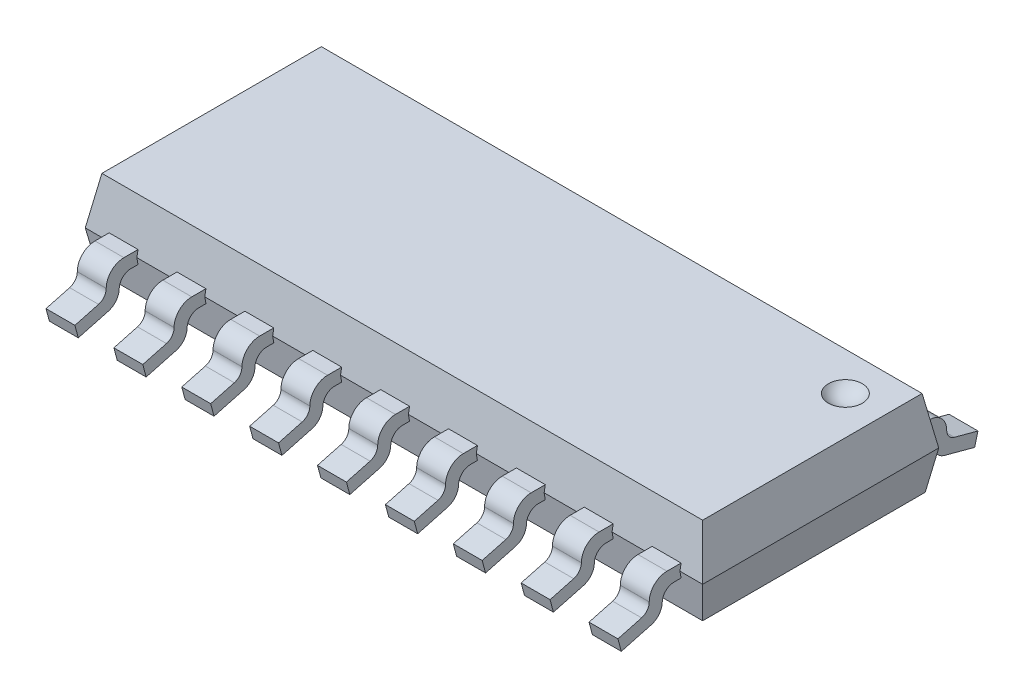
from build123d import *

# Parameters (mm, degrees)
BOSS_EXTRUDE1_DEPTH   = 5.23
CUT_EXTRUDE1_DEPTH    = 4.375
BOSS_EXTRUDE3_DEPTH   = 0.245
LPATTERN1_COUNT       = 5
LPATTERN1_PITCH       = 1.15
LPATTERN1_COUNT_DIR2  = 5
LPATTERN1_PITCH_DIR2  = 1.15
MIRROR1_COPY_1_DEPTH  = 0.245
MIRROR1_COPY_2_DEPTH  = 0.245
MIRROR1_COPY_3_DEPTH  = 0.245
MIRROR1_COPY_4_DEPTH  = 0.245
MIRROR1_COPY_5_DEPTH  = 0.245
MIRROR1_COPY_6_DEPTH  = 0.245
MIRROR1_COPY_7_DEPTH  = 0.245
MIRROR1_COPY_8_DEPTH  = 0.245
MIRROR1_COPY_9_DEPTH  = 0.245
MIRROR1_COPY_10_DEPTH = 0.245
MIRROR1_COPY_11_DEPTH = 0.245
MIRROR1_COPY_12_DEPTH = 0.245
MIRROR1_COPY_13_DEPTH = 0.245
MIRROR1_COPY_14_DEPTH = 0.245
MIRROR1_COPY_15_DEPTH = 0.245
MIRROR1_COPY_16_DEPTH = 0.245
MIRROR1_COPY_17_DEPTH = 0.245
MIRROR1_COPY_18_DEPTH = 0.245
MIRROR1_COPY_19_DEPTH = 0.245
MIRROR1_COPY_20_DEPTH = 0.245
MIRROR1_COPY_21_DEPTH = 0.245
MIRROR1_COPY_22_DEPTH = 0.245
MIRROR1_COPY_23_DEPTH = 0.245
MIRROR1_COPY_24_DEPTH = 0.245


with BuildPart() as part:
    # Sketch3 → Boss-Extrude1 (new, symmetric)
    with BuildSketch(Plane(origin=(0, 0, 0), x_dir=(0, 0, -1), z_dir=(1, 0, 0))):
        Polygon((-2, 0), (-1.885387463, -0.65), (1.885387463, -0.65), (2, 0), (1.858938415, 0.8), (-1.858938415, 0.8), align=None)
    extrude(amount=BOSS_EXTRUDE1_DEPTH, both=True)

    # Sketch4 → Cut-Extrude1 (cut, symmetric)
    with BuildSketch(Plane.XY):
        Polygon((-5.23, 0), (-5.088938415, 0.8), (-6, 0.8), (-6, -0.65), (-5.115387463, -0.65), align=None)
        Polygon((6, -0.65), (6, 0.8), (5.088938415, 0.8), (5.23, 0), (5.115387463, -0.65), align=None)
    extrude(amount=CUT_EXTRUDE1_DEPTH, both=True, mode=Mode.SUBTRACT)

    # Sketch8 → Boss-Extrude3 (add, symmetric)
    with BuildSketch(Plane(origin=(0, 0, 0), x_dir=(0, 0, -1), z_dir=(1, 0, 0))):
        with BuildLine():
            Line((-2, 0), (-1.980604032, 0.11))
            Line((-1.980604032, 0.11), (-2.22, 0.11))
            ThreePointArc((-2.22, 0.11), (-2.432132034, 0.022132034), (-2.52, -0.19))
            Line((-2.52, -0.19), (-2.52, -0.191271738))
            ThreePointArc((-2.52, -0.191271738), (-2.556144122, -0.297748886), (-2.649638362, -0.360219741))
            Line((-2.649638362, -0.360219741), (-3.05, -0.467496318))
            Line((-3.05, -0.467496318), (-2.99305981, -0.68))
            Line((-2.99305981, -0.68), (-2.485295239, -0.543944893))
            ThreePointArc((-2.485295239, -0.543944893), (-2.351661665, -0.454653794), (-2.3, -0.302463437))
            Line((-2.3, -0.302463437), (-2.3, -0.31))
            ThreePointArc((-2.3, -0.31), (-2.241421356, -0.168578644), (-2.1, -0.11))
            Line((-2.1, -0.11), (-1.980604032, -0.11))
            Line((-1.980604032, -0.11), (-2, 0))
        make_face()
    boss_extrude3 = extrude(amount=BOSS_EXTRUDE3_DEPTH, both=True)

    # Sketch9 → Cut-Revolve1 (revolve, cut)
    with BuildSketch(Plane(origin=(0, 1, 0), x_dir=(1, 0, 0), z_dir=(0, 1, 0))):
        with BuildLine():
            Line((4.788938415, 1.208938415), (4.088938415, 1.208938415))
            ThreePointArc((4.088938415, 1.208938415), (4.438938415, 1.558938415), (4.788938415, 1.208938415))
        make_face()
    revolve(axis=Axis((4.788938415, 1, -1.208938415), (-1, 0, 0)), mode=Mode.SUBTRACT)

    # LPattern1: Boss-Extrude3 5 × 5
    with Locations(*[Vector(1, 0, 0) * (i * LPATTERN1_PITCH) + Vector(-1, 0, 0) * (j * LPATTERN1_PITCH_DIR2) for i in range(LPATTERN1_COUNT) for j in range(LPATTERN1_COUNT_DIR2) if (i, j) != (0, 0)]):
        add(boss_extrude3)

    # Mirror1: Boss-Extrude3 across plane
    add(boss_extrude3.mirror(Plane.XY))

    # Mirror1 copy 1 sketch → Mirror1 copy 1 (add, symmetric)
    with BuildSketch(Plane(origin=(-1.15, 0, 0), x_dir=(0, 0, 1), z_dir=(1, 0, 0))):
        with BuildLine():
            Line((-2, 0), (-1.980604032, -0.11))
            Line((-1.980604032, -0.11), (-2.22, -0.11))
            ThreePointArc((-2.22, -0.11), (-2.432132034, -0.022132034), (-2.52, 0.19))
            Line((-2.52, 0.19), (-2.52, 0.191271738))
            ThreePointArc((-2.52, 0.191271738), (-2.556144122, 0.297748886), (-2.649638362, 0.360219741))
            Line((-2.649638362, 0.360219741), (-3.05, 0.467496318))
            Line((-3.05, 0.467496318), (-2.99305981, 0.68))
            Line((-2.99305981, 0.68), (-2.485295239, 0.543944893))
            ThreePointArc((-2.485295239, 0.543944893), (-2.351661665, 0.454653794), (-2.3, 0.302463437))
            Line((-2.3, 0.302463437), (-2.3, 0.31))
            ThreePointArc((-2.3, 0.31), (-2.241421356, 0.168578644), (-2.1, 0.11))
            Line((-2.1, 0.11), (-1.980604032, 0.11))
            Line((-1.980604032, 0.11), (-2, 0))
        make_face()
    extrude(amount=MIRROR1_COPY_1_DEPTH, both=True)

    # Mirror1 copy 2 sketch → Mirror1 copy 2 (add, symmetric)
    with BuildSketch(Plane(origin=(-2.3, 0, 0), x_dir=(0, 0, 1), z_dir=(1, 0, 0))):
        with BuildLine():
            Line((-2, 0), (-1.980604032, -0.11))
            Line((-1.980604032, -0.11), (-2.22, -0.11))
            ThreePointArc((-2.22, -0.11), (-2.432132034, -0.022132034), (-2.52, 0.19))
            Line((-2.52, 0.19), (-2.52, 0.191271738))
            ThreePointArc((-2.52, 0.191271738), (-2.556144122, 0.297748886), (-2.649638362, 0.360219741))
            Line((-2.649638362, 0.360219741), (-3.05, 0.467496318))
            Line((-3.05, 0.467496318), (-2.99305981, 0.68))
            Line((-2.99305981, 0.68), (-2.485295239, 0.543944893))
            ThreePointArc((-2.485295239, 0.543944893), (-2.351661665, 0.454653794), (-2.3, 0.302463437))
            Line((-2.3, 0.302463437), (-2.3, 0.31))
            ThreePointArc((-2.3, 0.31), (-2.241421356, 0.168578644), (-2.1, 0.11))
            Line((-2.1, 0.11), (-1.980604032, 0.11))
            Line((-1.980604032, 0.11), (-2, 0))
        make_face()
    extrude(amount=MIRROR1_COPY_2_DEPTH, both=True)

    # Mirror1 copy 3 sketch → Mirror1 copy 3 (add, symmetric)
    with BuildSketch(Plane(origin=(-3.45, 0, 0), x_dir=(0, 0, 1), z_dir=(1, 0, 0))):
        with BuildLine():
            Line((-2, 0), (-1.980604032, -0.11))
            Line((-1.980604032, -0.11), (-2.22, -0.11))
            ThreePointArc((-2.22, -0.11), (-2.432132034, -0.022132034), (-2.52, 0.19))
            Line((-2.52, 0.19), (-2.52, 0.191271738))
            ThreePointArc((-2.52, 0.191271738), (-2.556144122, 0.297748886), (-2.649638362, 0.360219741))
            Line((-2.649638362, 0.360219741), (-3.05, 0.467496318))
            Line((-3.05, 0.467496318), (-2.99305981, 0.68))
            Line((-2.99305981, 0.68), (-2.485295239, 0.543944893))
            ThreePointArc((-2.485295239, 0.543944893), (-2.351661665, 0.454653794), (-2.3, 0.302463437))
            Line((-2.3, 0.302463437), (-2.3, 0.31))
            ThreePointArc((-2.3, 0.31), (-2.241421356, 0.168578644), (-2.1, 0.11))
            Line((-2.1, 0.11), (-1.980604032, 0.11))
            Line((-1.980604032, 0.11), (-2, 0))
        make_face()
    extrude(amount=MIRROR1_COPY_3_DEPTH, both=True)

    # Mirror1 copy 4 sketch → Mirror1 copy 4 (add, symmetric)
    with BuildSketch(Plane(origin=(-4.6, 0, 0), x_dir=(0, 0, 1), z_dir=(1, 0, 0))):
        with BuildLine():
            Line((-2, 0), (-1.980604032, -0.11))
            Line((-1.980604032, -0.11), (-2.22, -0.11))
            ThreePointArc((-2.22, -0.11), (-2.432132034, -0.022132034), (-2.52, 0.19))
            Line((-2.52, 0.19), (-2.52, 0.191271738))
            ThreePointArc((-2.52, 0.191271738), (-2.556144122, 0.297748886), (-2.649638362, 0.360219741))
            Line((-2.649638362, 0.360219741), (-3.05, 0.467496318))
            Line((-3.05, 0.467496318), (-2.99305981, 0.68))
            Line((-2.99305981, 0.68), (-2.485295239, 0.543944893))
            ThreePointArc((-2.485295239, 0.543944893), (-2.351661665, 0.454653794), (-2.3, 0.302463437))
            Line((-2.3, 0.302463437), (-2.3, 0.31))
            ThreePointArc((-2.3, 0.31), (-2.241421356, 0.168578644), (-2.1, 0.11))
            Line((-2.1, 0.11), (-1.980604032, 0.11))
            Line((-1.980604032, 0.11), (-2, 0))
        make_face()
    extrude(amount=MIRROR1_COPY_4_DEPTH, both=True)

    # Mirror1 copy 5 sketch → Mirror1 copy 5 (add, symmetric)
    with BuildSketch(Plane(origin=(1.15, 0, 0), x_dir=(0, 0, 1), z_dir=(1, 0, 0))):
        with BuildLine():
            Line((-2, 0), (-1.980604032, -0.11))
            Line((-1.980604032, -0.11), (-2.22, -0.11))
            ThreePointArc((-2.22, -0.11), (-2.432132034, -0.022132034), (-2.52, 0.19))
            Line((-2.52, 0.19), (-2.52, 0.191271738))
            ThreePointArc((-2.52, 0.191271738), (-2.556144122, 0.297748886), (-2.649638362, 0.360219741))
            Line((-2.649638362, 0.360219741), (-3.05, 0.467496318))
            Line((-3.05, 0.467496318), (-2.99305981, 0.68))
            Line((-2.99305981, 0.68), (-2.485295239, 0.543944893))
            ThreePointArc((-2.485295239, 0.543944893), (-2.351661665, 0.454653794), (-2.3, 0.302463437))
            Line((-2.3, 0.302463437), (-2.3, 0.31))
            ThreePointArc((-2.3, 0.31), (-2.241421356, 0.168578644), (-2.1, 0.11))
            Line((-2.1, 0.11), (-1.980604032, 0.11))
            Line((-1.980604032, 0.11), (-2, 0))
        make_face()
    extrude(amount=MIRROR1_COPY_5_DEPTH, both=True)

    # Mirror1 copy 6 sketch → Mirror1 copy 6 (add, symmetric)
    with BuildSketch(Plane(origin=(0, 0, 0), x_dir=(0, 0, 1), z_dir=(1, 0, 0))):
        with BuildLine():
            Line((-2, 0), (-1.980604032, -0.11))
            Line((-1.980604032, -0.11), (-2.22, -0.11))
            ThreePointArc((-2.22, -0.11), (-2.432132034, -0.022132034), (-2.52, 0.19))
            Line((-2.52, 0.19), (-2.52, 0.191271738))
            ThreePointArc((-2.52, 0.191271738), (-2.556144122, 0.297748886), (-2.649638362, 0.360219741))
            Line((-2.649638362, 0.360219741), (-3.05, 0.467496318))
            Line((-3.05, 0.467496318), (-2.99305981, 0.68))
            Line((-2.99305981, 0.68), (-2.485295239, 0.543944893))
            ThreePointArc((-2.485295239, 0.543944893), (-2.351661665, 0.454653794), (-2.3, 0.302463437))
            Line((-2.3, 0.302463437), (-2.3, 0.31))
            ThreePointArc((-2.3, 0.31), (-2.241421356, 0.168578644), (-2.1, 0.11))
            Line((-2.1, 0.11), (-1.980604032, 0.11))
            Line((-1.980604032, 0.11), (-2, 0))
        make_face()
    extrude(amount=MIRROR1_COPY_6_DEPTH, both=True)

    # Mirror1 copy 7 sketch → Mirror1 copy 7 (add, symmetric)
    with BuildSketch(Plane(origin=(-1.15, 0, 0), x_dir=(0, 0, 1), z_dir=(1, 0, 0))):
        with BuildLine():
            Line((-2, 0), (-1.980604032, -0.11))
            Line((-1.980604032, -0.11), (-2.22, -0.11))
            ThreePointArc((-2.22, -0.11), (-2.432132034, -0.022132034), (-2.52, 0.19))
            Line((-2.52, 0.19), (-2.52, 0.191271738))
            ThreePointArc((-2.52, 0.191271738), (-2.556144122, 0.297748886), (-2.649638362, 0.360219741))
            Line((-2.649638362, 0.360219741), (-3.05, 0.467496318))
            Line((-3.05, 0.467496318), (-2.99305981, 0.68))
            Line((-2.99305981, 0.68), (-2.485295239, 0.543944893))
            ThreePointArc((-2.485295239, 0.543944893), (-2.351661665, 0.454653794), (-2.3, 0.302463437))
            Line((-2.3, 0.302463437), (-2.3, 0.31))
            ThreePointArc((-2.3, 0.31), (-2.241421356, 0.168578644), (-2.1, 0.11))
            Line((-2.1, 0.11), (-1.980604032, 0.11))
            Line((-1.980604032, 0.11), (-2, 0))
        make_face()
    extrude(amount=MIRROR1_COPY_7_DEPTH, both=True)

    # Mirror1 copy 8 sketch → Mirror1 copy 8 (add, symmetric)
    with BuildSketch(Plane(origin=(-2.3, 0, 0), x_dir=(0, 0, 1), z_dir=(1, 0, 0))):
        with BuildLine():
            Line((-2, 0), (-1.980604032, -0.11))
            Line((-1.980604032, -0.11), (-2.22, -0.11))
            ThreePointArc((-2.22, -0.11), (-2.432132034, -0.022132034), (-2.52, 0.19))
            Line((-2.52, 0.19), (-2.52, 0.191271738))
            ThreePointArc((-2.52, 0.191271738), (-2.556144122, 0.297748886), (-2.649638362, 0.360219741))
            Line((-2.649638362, 0.360219741), (-3.05, 0.467496318))
            Line((-3.05, 0.467496318), (-2.99305981, 0.68))
            Line((-2.99305981, 0.68), (-2.485295239, 0.543944893))
            ThreePointArc((-2.485295239, 0.543944893), (-2.351661665, 0.454653794), (-2.3, 0.302463437))
            Line((-2.3, 0.302463437), (-2.3, 0.31))
            ThreePointArc((-2.3, 0.31), (-2.241421356, 0.168578644), (-2.1, 0.11))
            Line((-2.1, 0.11), (-1.980604032, 0.11))
            Line((-1.980604032, 0.11), (-2, 0))
        make_face()
    extrude(amount=MIRROR1_COPY_8_DEPTH, both=True)

    # Mirror1 copy 9 sketch → Mirror1 copy 9 (add, symmetric)
    with BuildSketch(Plane(origin=(-3.45, 0, 0), x_dir=(0, 0, 1), z_dir=(1, 0, 0))):
        with BuildLine():
            Line((-2, 0), (-1.980604032, -0.11))
            Line((-1.980604032, -0.11), (-2.22, -0.11))
            ThreePointArc((-2.22, -0.11), (-2.432132034, -0.022132034), (-2.52, 0.19))
            Line((-2.52, 0.19), (-2.52, 0.191271738))
            ThreePointArc((-2.52, 0.191271738), (-2.556144122, 0.297748886), (-2.649638362, 0.360219741))
            Line((-2.649638362, 0.360219741), (-3.05, 0.467496318))
            Line((-3.05, 0.467496318), (-2.99305981, 0.68))
            Line((-2.99305981, 0.68), (-2.485295239, 0.543944893))
            ThreePointArc((-2.485295239, 0.543944893), (-2.351661665, 0.454653794), (-2.3, 0.302463437))
            Line((-2.3, 0.302463437), (-2.3, 0.31))
            ThreePointArc((-2.3, 0.31), (-2.241421356, 0.168578644), (-2.1, 0.11))
            Line((-2.1, 0.11), (-1.980604032, 0.11))
            Line((-1.980604032, 0.11), (-2, 0))
        make_face()
    extrude(amount=MIRROR1_COPY_9_DEPTH, both=True)

    # Mirror1 copy 10 sketch → Mirror1 copy 10 (add, symmetric)
    with BuildSketch(Plane(origin=(2.3, 0, 0), x_dir=(0, 0, 1), z_dir=(1, 0, 0))):
        with BuildLine():
            Line((-2, 0), (-1.980604032, -0.11))
            Line((-1.980604032, -0.11), (-2.22, -0.11))
            ThreePointArc((-2.22, -0.11), (-2.432132034, -0.022132034), (-2.52, 0.19))
            Line((-2.52, 0.19), (-2.52, 0.191271738))
            ThreePointArc((-2.52, 0.191271738), (-2.556144122, 0.297748886), (-2.649638362, 0.360219741))
            Line((-2.649638362, 0.360219741), (-3.05, 0.467496318))
            Line((-3.05, 0.467496318), (-2.99305981, 0.68))
            Line((-2.99305981, 0.68), (-2.485295239, 0.543944893))
            ThreePointArc((-2.485295239, 0.543944893), (-2.351661665, 0.454653794), (-2.3, 0.302463437))
            Line((-2.3, 0.302463437), (-2.3, 0.31))
            ThreePointArc((-2.3, 0.31), (-2.241421356, 0.168578644), (-2.1, 0.11))
            Line((-2.1, 0.11), (-1.980604032, 0.11))
            Line((-1.980604032, 0.11), (-2, 0))
        make_face()
    extrude(amount=MIRROR1_COPY_10_DEPTH, both=True)

    # Mirror1 copy 11 sketch → Mirror1 copy 11 (add, symmetric)
    with BuildSketch(Plane(origin=(1.15, 0, 0), x_dir=(0, 0, 1), z_dir=(1, 0, 0))):
        with BuildLine():
            Line((-2, 0), (-1.980604032, -0.11))
            Line((-1.980604032, -0.11), (-2.22, -0.11))
            ThreePointArc((-2.22, -0.11), (-2.432132034, -0.022132034), (-2.52, 0.19))
            Line((-2.52, 0.19), (-2.52, 0.191271738))
            ThreePointArc((-2.52, 0.191271738), (-2.556144122, 0.297748886), (-2.649638362, 0.360219741))
            Line((-2.649638362, 0.360219741), (-3.05, 0.467496318))
            Line((-3.05, 0.467496318), (-2.99305981, 0.68))
            Line((-2.99305981, 0.68), (-2.485295239, 0.543944893))
            ThreePointArc((-2.485295239, 0.543944893), (-2.351661665, 0.454653794), (-2.3, 0.302463437))
            Line((-2.3, 0.302463437), (-2.3, 0.31))
            ThreePointArc((-2.3, 0.31), (-2.241421356, 0.168578644), (-2.1, 0.11))
            Line((-2.1, 0.11), (-1.980604032, 0.11))
            Line((-1.980604032, 0.11), (-2, 0))
        make_face()
    extrude(amount=MIRROR1_COPY_11_DEPTH, both=True)

    # Mirror1 copy 12 sketch → Mirror1 copy 12 (add, symmetric)
    with BuildSketch(Plane(origin=(0, 0, 0), x_dir=(0, 0, 1), z_dir=(1, 0, 0))):
        with BuildLine():
            Line((-2, 0), (-1.980604032, -0.11))
            Line((-1.980604032, -0.11), (-2.22, -0.11))
            ThreePointArc((-2.22, -0.11), (-2.432132034, -0.022132034), (-2.52, 0.19))
            Line((-2.52, 0.19), (-2.52, 0.191271738))
            ThreePointArc((-2.52, 0.191271738), (-2.556144122, 0.297748886), (-2.649638362, 0.360219741))
            Line((-2.649638362, 0.360219741), (-3.05, 0.467496318))
            Line((-3.05, 0.467496318), (-2.99305981, 0.68))
            Line((-2.99305981, 0.68), (-2.485295239, 0.543944893))
            ThreePointArc((-2.485295239, 0.543944893), (-2.351661665, 0.454653794), (-2.3, 0.302463437))
            Line((-2.3, 0.302463437), (-2.3, 0.31))
            ThreePointArc((-2.3, 0.31), (-2.241421356, 0.168578644), (-2.1, 0.11))
            Line((-2.1, 0.11), (-1.980604032, 0.11))
            Line((-1.980604032, 0.11), (-2, 0))
        make_face()
    extrude(amount=MIRROR1_COPY_12_DEPTH, both=True)

    # Mirror1 copy 13 sketch → Mirror1 copy 13 (add, symmetric)
    with BuildSketch(Plane(origin=(-1.15, 0, 0), x_dir=(0, 0, 1), z_dir=(1, 0, 0))):
        with BuildLine():
            Line((-2, 0), (-1.980604032, -0.11))
            Line((-1.980604032, -0.11), (-2.22, -0.11))
            ThreePointArc((-2.22, -0.11), (-2.432132034, -0.022132034), (-2.52, 0.19))
            Line((-2.52, 0.19), (-2.52, 0.191271738))
            ThreePointArc((-2.52, 0.191271738), (-2.556144122, 0.297748886), (-2.649638362, 0.360219741))
            Line((-2.649638362, 0.360219741), (-3.05, 0.467496318))
            Line((-3.05, 0.467496318), (-2.99305981, 0.68))
            Line((-2.99305981, 0.68), (-2.485295239, 0.543944893))
            ThreePointArc((-2.485295239, 0.543944893), (-2.351661665, 0.454653794), (-2.3, 0.302463437))
            Line((-2.3, 0.302463437), (-2.3, 0.31))
            ThreePointArc((-2.3, 0.31), (-2.241421356, 0.168578644), (-2.1, 0.11))
            Line((-2.1, 0.11), (-1.980604032, 0.11))
            Line((-1.980604032, 0.11), (-2, 0))
        make_face()
    extrude(amount=MIRROR1_COPY_13_DEPTH, both=True)

    # Mirror1 copy 14 sketch → Mirror1 copy 14 (add, symmetric)
    with BuildSketch(Plane(origin=(-2.3, 0, 0), x_dir=(0, 0, 1), z_dir=(1, 0, 0))):
        with BuildLine():
            Line((-2, 0), (-1.980604032, -0.11))
            Line((-1.980604032, -0.11), (-2.22, -0.11))
            ThreePointArc((-2.22, -0.11), (-2.432132034, -0.022132034), (-2.52, 0.19))
            Line((-2.52, 0.19), (-2.52, 0.191271738))
            ThreePointArc((-2.52, 0.191271738), (-2.556144122, 0.297748886), (-2.649638362, 0.360219741))
            Line((-2.649638362, 0.360219741), (-3.05, 0.467496318))
            Line((-3.05, 0.467496318), (-2.99305981, 0.68))
            Line((-2.99305981, 0.68), (-2.485295239, 0.543944893))
            ThreePointArc((-2.485295239, 0.543944893), (-2.351661665, 0.454653794), (-2.3, 0.302463437))
            Line((-2.3, 0.302463437), (-2.3, 0.31))
            ThreePointArc((-2.3, 0.31), (-2.241421356, 0.168578644), (-2.1, 0.11))
            Line((-2.1, 0.11), (-1.980604032, 0.11))
            Line((-1.980604032, 0.11), (-2, 0))
        make_face()
    extrude(amount=MIRROR1_COPY_14_DEPTH, both=True)

    # Mirror1 copy 15 sketch → Mirror1 copy 15 (add, symmetric)
    with BuildSketch(Plane(origin=(3.45, 0, 0), x_dir=(0, 0, 1), z_dir=(1, 0, 0))):
        with BuildLine():
            Line((-2, 0), (-1.980604032, -0.11))
            Line((-1.980604032, -0.11), (-2.22, -0.11))
            ThreePointArc((-2.22, -0.11), (-2.432132034, -0.022132034), (-2.52, 0.19))
            Line((-2.52, 0.19), (-2.52, 0.191271738))
            ThreePointArc((-2.52, 0.191271738), (-2.556144122, 0.297748886), (-2.649638362, 0.360219741))
            Line((-2.649638362, 0.360219741), (-3.05, 0.467496318))
            Line((-3.05, 0.467496318), (-2.99305981, 0.68))
            Line((-2.99305981, 0.68), (-2.485295239, 0.543944893))
            ThreePointArc((-2.485295239, 0.543944893), (-2.351661665, 0.454653794), (-2.3, 0.302463437))
            Line((-2.3, 0.302463437), (-2.3, 0.31))
            ThreePointArc((-2.3, 0.31), (-2.241421356, 0.168578644), (-2.1, 0.11))
            Line((-2.1, 0.11), (-1.980604032, 0.11))
            Line((-1.980604032, 0.11), (-2, 0))
        make_face()
    extrude(amount=MIRROR1_COPY_15_DEPTH, both=True)

    # Mirror1 copy 16 sketch → Mirror1 copy 16 (add, symmetric)
    with BuildSketch(Plane(origin=(2.3, 0, 0), x_dir=(0, 0, 1), z_dir=(1, 0, 0))):
        with BuildLine():
            Line((-2, 0), (-1.980604032, -0.11))
            Line((-1.980604032, -0.11), (-2.22, -0.11))
            ThreePointArc((-2.22, -0.11), (-2.432132034, -0.022132034), (-2.52, 0.19))
            Line((-2.52, 0.19), (-2.52, 0.191271738))
            ThreePointArc((-2.52, 0.191271738), (-2.556144122, 0.297748886), (-2.649638362, 0.360219741))
            Line((-2.649638362, 0.360219741), (-3.05, 0.467496318))
            Line((-3.05, 0.467496318), (-2.99305981, 0.68))
            Line((-2.99305981, 0.68), (-2.485295239, 0.543944893))
            ThreePointArc((-2.485295239, 0.543944893), (-2.351661665, 0.454653794), (-2.3, 0.302463437))
            Line((-2.3, 0.302463437), (-2.3, 0.31))
            ThreePointArc((-2.3, 0.31), (-2.241421356, 0.168578644), (-2.1, 0.11))
            Line((-2.1, 0.11), (-1.980604032, 0.11))
            Line((-1.980604032, 0.11), (-2, 0))
        make_face()
    extrude(amount=MIRROR1_COPY_16_DEPTH, both=True)

    # Mirror1 copy 17 sketch → Mirror1 copy 17 (add, symmetric)
    with BuildSketch(Plane(origin=(1.15, 0, 0), x_dir=(0, 0, 1), z_dir=(1, 0, 0))):
        with BuildLine():
            Line((-2, 0), (-1.980604032, -0.11))
            Line((-1.980604032, -0.11), (-2.22, -0.11))
            ThreePointArc((-2.22, -0.11), (-2.432132034, -0.022132034), (-2.52, 0.19))
            Line((-2.52, 0.19), (-2.52, 0.191271738))
            ThreePointArc((-2.52, 0.191271738), (-2.556144122, 0.297748886), (-2.649638362, 0.360219741))
            Line((-2.649638362, 0.360219741), (-3.05, 0.467496318))
            Line((-3.05, 0.467496318), (-2.99305981, 0.68))
            Line((-2.99305981, 0.68), (-2.485295239, 0.543944893))
            ThreePointArc((-2.485295239, 0.543944893), (-2.351661665, 0.454653794), (-2.3, 0.302463437))
            Line((-2.3, 0.302463437), (-2.3, 0.31))
            ThreePointArc((-2.3, 0.31), (-2.241421356, 0.168578644), (-2.1, 0.11))
            Line((-2.1, 0.11), (-1.980604032, 0.11))
            Line((-1.980604032, 0.11), (-2, 0))
        make_face()
    extrude(amount=MIRROR1_COPY_17_DEPTH, both=True)

    # Mirror1 copy 18 sketch → Mirror1 copy 18 (add, symmetric)
    with BuildSketch(Plane(origin=(0, 0, 0), x_dir=(0, 0, 1), z_dir=(1, 0, 0))):
        with BuildLine():
            Line((-2, 0), (-1.980604032, -0.11))
            Line((-1.980604032, -0.11), (-2.22, -0.11))
            ThreePointArc((-2.22, -0.11), (-2.432132034, -0.022132034), (-2.52, 0.19))
            Line((-2.52, 0.19), (-2.52, 0.191271738))
            ThreePointArc((-2.52, 0.191271738), (-2.556144122, 0.297748886), (-2.649638362, 0.360219741))
            Line((-2.649638362, 0.360219741), (-3.05, 0.467496318))
            Line((-3.05, 0.467496318), (-2.99305981, 0.68))
            Line((-2.99305981, 0.68), (-2.485295239, 0.543944893))
            ThreePointArc((-2.485295239, 0.543944893), (-2.351661665, 0.454653794), (-2.3, 0.302463437))
            Line((-2.3, 0.302463437), (-2.3, 0.31))
            ThreePointArc((-2.3, 0.31), (-2.241421356, 0.168578644), (-2.1, 0.11))
            Line((-2.1, 0.11), (-1.980604032, 0.11))
            Line((-1.980604032, 0.11), (-2, 0))
        make_face()
    extrude(amount=MIRROR1_COPY_18_DEPTH, both=True)

    # Mirror1 copy 19 sketch → Mirror1 copy 19 (add, symmetric)
    with BuildSketch(Plane(origin=(-1.15, 0, 0), x_dir=(0, 0, 1), z_dir=(1, 0, 0))):
        with BuildLine():
            Line((-2, 0), (-1.980604032, -0.11))
            Line((-1.980604032, -0.11), (-2.22, -0.11))
            ThreePointArc((-2.22, -0.11), (-2.432132034, -0.022132034), (-2.52, 0.19))
            Line((-2.52, 0.19), (-2.52, 0.191271738))
            ThreePointArc((-2.52, 0.191271738), (-2.556144122, 0.297748886), (-2.649638362, 0.360219741))
            Line((-2.649638362, 0.360219741), (-3.05, 0.467496318))
            Line((-3.05, 0.467496318), (-2.99305981, 0.68))
            Line((-2.99305981, 0.68), (-2.485295239, 0.543944893))
            ThreePointArc((-2.485295239, 0.543944893), (-2.351661665, 0.454653794), (-2.3, 0.302463437))
            Line((-2.3, 0.302463437), (-2.3, 0.31))
            ThreePointArc((-2.3, 0.31), (-2.241421356, 0.168578644), (-2.1, 0.11))
            Line((-2.1, 0.11), (-1.980604032, 0.11))
            Line((-1.980604032, 0.11), (-2, 0))
        make_face()
    extrude(amount=MIRROR1_COPY_19_DEPTH, both=True)

    # Mirror1 copy 20 sketch → Mirror1 copy 20 (add, symmetric)
    with BuildSketch(Plane(origin=(4.6, 0, 0), x_dir=(0, 0, 1), z_dir=(1, 0, 0))):
        with BuildLine():
            Line((-2, 0), (-1.980604032, -0.11))
            Line((-1.980604032, -0.11), (-2.22, -0.11))
            ThreePointArc((-2.22, -0.11), (-2.432132034, -0.022132034), (-2.52, 0.19))
            Line((-2.52, 0.19), (-2.52, 0.191271738))
            ThreePointArc((-2.52, 0.191271738), (-2.556144122, 0.297748886), (-2.649638362, 0.360219741))
            Line((-2.649638362, 0.360219741), (-3.05, 0.467496318))
            Line((-3.05, 0.467496318), (-2.99305981, 0.68))
            Line((-2.99305981, 0.68), (-2.485295239, 0.543944893))
            ThreePointArc((-2.485295239, 0.543944893), (-2.351661665, 0.454653794), (-2.3, 0.302463437))
            Line((-2.3, 0.302463437), (-2.3, 0.31))
            ThreePointArc((-2.3, 0.31), (-2.241421356, 0.168578644), (-2.1, 0.11))
            Line((-2.1, 0.11), (-1.980604032, 0.11))
            Line((-1.980604032, 0.11), (-2, 0))
        make_face()
    extrude(amount=MIRROR1_COPY_20_DEPTH, both=True)

    # Mirror1 copy 21 sketch → Mirror1 copy 21 (add, symmetric)
    with BuildSketch(Plane(origin=(3.45, 0, 0), x_dir=(0, 0, 1), z_dir=(1, 0, 0))):
        with BuildLine():
            Line((-2, 0), (-1.980604032, -0.11))
            Line((-1.980604032, -0.11), (-2.22, -0.11))
            ThreePointArc((-2.22, -0.11), (-2.432132034, -0.022132034), (-2.52, 0.19))
            Line((-2.52, 0.19), (-2.52, 0.191271738))
            ThreePointArc((-2.52, 0.191271738), (-2.556144122, 0.297748886), (-2.649638362, 0.360219741))
            Line((-2.649638362, 0.360219741), (-3.05, 0.467496318))
            Line((-3.05, 0.467496318), (-2.99305981, 0.68))
            Line((-2.99305981, 0.68), (-2.485295239, 0.543944893))
            ThreePointArc((-2.485295239, 0.543944893), (-2.351661665, 0.454653794), (-2.3, 0.302463437))
            Line((-2.3, 0.302463437), (-2.3, 0.31))
            ThreePointArc((-2.3, 0.31), (-2.241421356, 0.168578644), (-2.1, 0.11))
            Line((-2.1, 0.11), (-1.980604032, 0.11))
            Line((-1.980604032, 0.11), (-2, 0))
        make_face()
    extrude(amount=MIRROR1_COPY_21_DEPTH, both=True)

    # Mirror1 copy 22 sketch → Mirror1 copy 22 (add, symmetric)
    with BuildSketch(Plane(origin=(2.3, 0, 0), x_dir=(0, 0, 1), z_dir=(1, 0, 0))):
        with BuildLine():
            Line((-2, 0), (-1.980604032, -0.11))
            Line((-1.980604032, -0.11), (-2.22, -0.11))
            ThreePointArc((-2.22, -0.11), (-2.432132034, -0.022132034), (-2.52, 0.19))
            Line((-2.52, 0.19), (-2.52, 0.191271738))
            ThreePointArc((-2.52, 0.191271738), (-2.556144122, 0.297748886), (-2.649638362, 0.360219741))
            Line((-2.649638362, 0.360219741), (-3.05, 0.467496318))
            Line((-3.05, 0.467496318), (-2.99305981, 0.68))
            Line((-2.99305981, 0.68), (-2.485295239, 0.543944893))
            ThreePointArc((-2.485295239, 0.543944893), (-2.351661665, 0.454653794), (-2.3, 0.302463437))
            Line((-2.3, 0.302463437), (-2.3, 0.31))
            ThreePointArc((-2.3, 0.31), (-2.241421356, 0.168578644), (-2.1, 0.11))
            Line((-2.1, 0.11), (-1.980604032, 0.11))
            Line((-1.980604032, 0.11), (-2, 0))
        make_face()
    extrude(amount=MIRROR1_COPY_22_DEPTH, both=True)

    # Mirror1 copy 23 sketch → Mirror1 copy 23 (add, symmetric)
    with BuildSketch(Plane(origin=(1.15, 0, 0), x_dir=(0, 0, 1), z_dir=(1, 0, 0))):
        with BuildLine():
            Line((-2, 0), (-1.980604032, -0.11))
            Line((-1.980604032, -0.11), (-2.22, -0.11))
            ThreePointArc((-2.22, -0.11), (-2.432132034, -0.022132034), (-2.52, 0.19))
            Line((-2.52, 0.19), (-2.52, 0.191271738))
            ThreePointArc((-2.52, 0.191271738), (-2.556144122, 0.297748886), (-2.649638362, 0.360219741))
            Line((-2.649638362, 0.360219741), (-3.05, 0.467496318))
            Line((-3.05, 0.467496318), (-2.99305981, 0.68))
            Line((-2.99305981, 0.68), (-2.485295239, 0.543944893))
            ThreePointArc((-2.485295239, 0.543944893), (-2.351661665, 0.454653794), (-2.3, 0.302463437))
            Line((-2.3, 0.302463437), (-2.3, 0.31))
            ThreePointArc((-2.3, 0.31), (-2.241421356, 0.168578644), (-2.1, 0.11))
            Line((-2.1, 0.11), (-1.980604032, 0.11))
            Line((-1.980604032, 0.11), (-2, 0))
        make_face()
    extrude(amount=MIRROR1_COPY_23_DEPTH, both=True)

    # Mirror1 copy 24 sketch → Mirror1 copy 24 (add, symmetric)
    with BuildSketch(Plane(origin=(0, 0, 0), x_dir=(0, 0, 1), z_dir=(1, 0, 0))):
        with BuildLine():
            Line((-2, 0), (-1.980604032, -0.11))
            Line((-1.980604032, -0.11), (-2.22, -0.11))
            ThreePointArc((-2.22, -0.11), (-2.432132034, -0.022132034), (-2.52, 0.19))
            Line((-2.52, 0.19), (-2.52, 0.191271738))
            ThreePointArc((-2.52, 0.191271738), (-2.556144122, 0.297748886), (-2.649638362, 0.360219741))
            Line((-2.649638362, 0.360219741), (-3.05, 0.467496318))
            Line((-3.05, 0.467496318), (-2.99305981, 0.68))
            Line((-2.99305981, 0.68), (-2.485295239, 0.543944893))
            ThreePointArc((-2.485295239, 0.543944893), (-2.351661665, 0.454653794), (-2.3, 0.302463437))
            Line((-2.3, 0.302463437), (-2.3, 0.31))
            ThreePointArc((-2.3, 0.31), (-2.241421356, 0.168578644), (-2.1, 0.11))
            Line((-2.1, 0.11), (-1.980604032, 0.11))
            Line((-1.980604032, 0.11), (-2, 0))
        make_face()
    extrude(amount=MIRROR1_COPY_24_DEPTH, both=True)


solid = part.part
